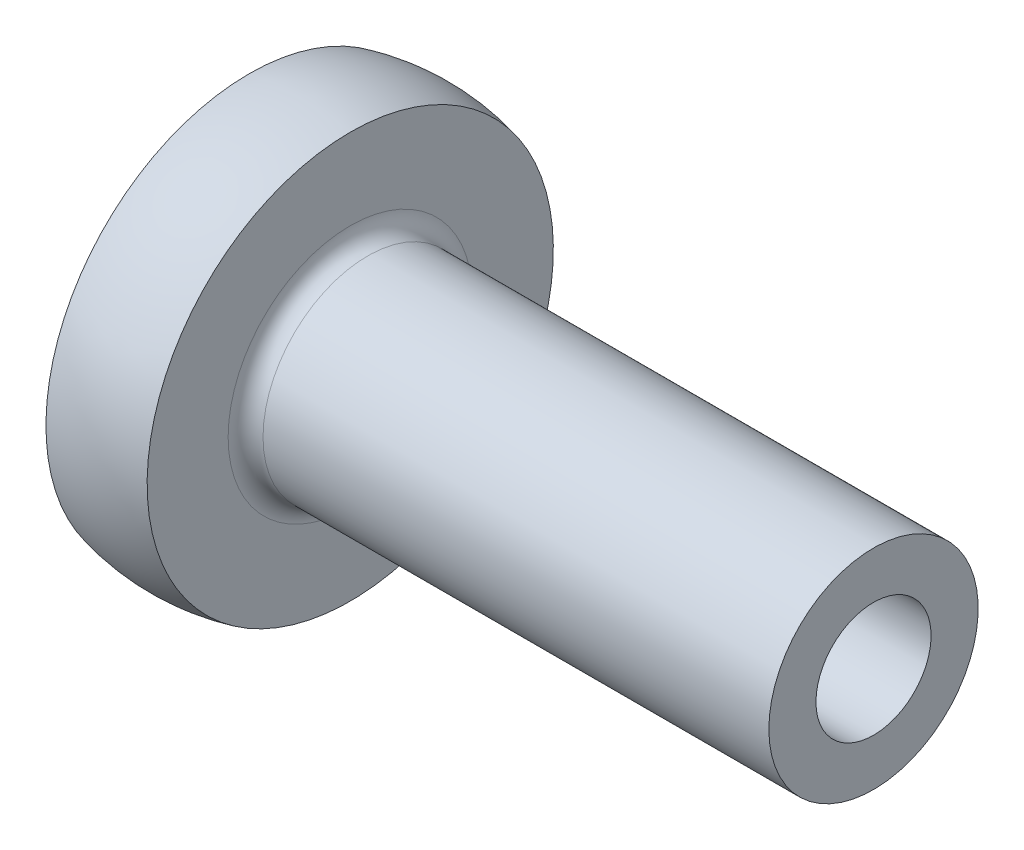
from build123d import *

# Parameters (mm, degrees)
FILLET1_R = 0.1


with BuildPart() as part:
    # Sketch1 → Base-Revolve (revolve)
    with BuildSketch(Plane.XY):
        with BuildLine():
            Line((0, 1.164431192), (0, 0))
            Line((0, 0), (1.949474411, 0))
            Line((1.949474411, 0), (2.14, 0.33))
            Line((2.14, 0.33), (3.58, 0.33))
            Line((3.58, 0.33), (3.58, 0.6))
            Line((3.58, 0.6), (0.58, 0.6))
            Line((0.58, 0.6), (0.58, 1.164431192))
            ThreePointArc((0.58, 1.164431192), (0.29, 1.2), (0, 1.164431192))
        make_face()
    revolve(axis=Axis((-2.318253968, 0, 0), (1, 0, 0)))

    # Fillet1
    fillet1_edges = [part.edges().sort_by_distance(p)[0] for p in [
        (0.58, -0.6, 0),
    ]]
    fillet(fillet1_edges, radius=FILLET1_R)


solid = part.part
